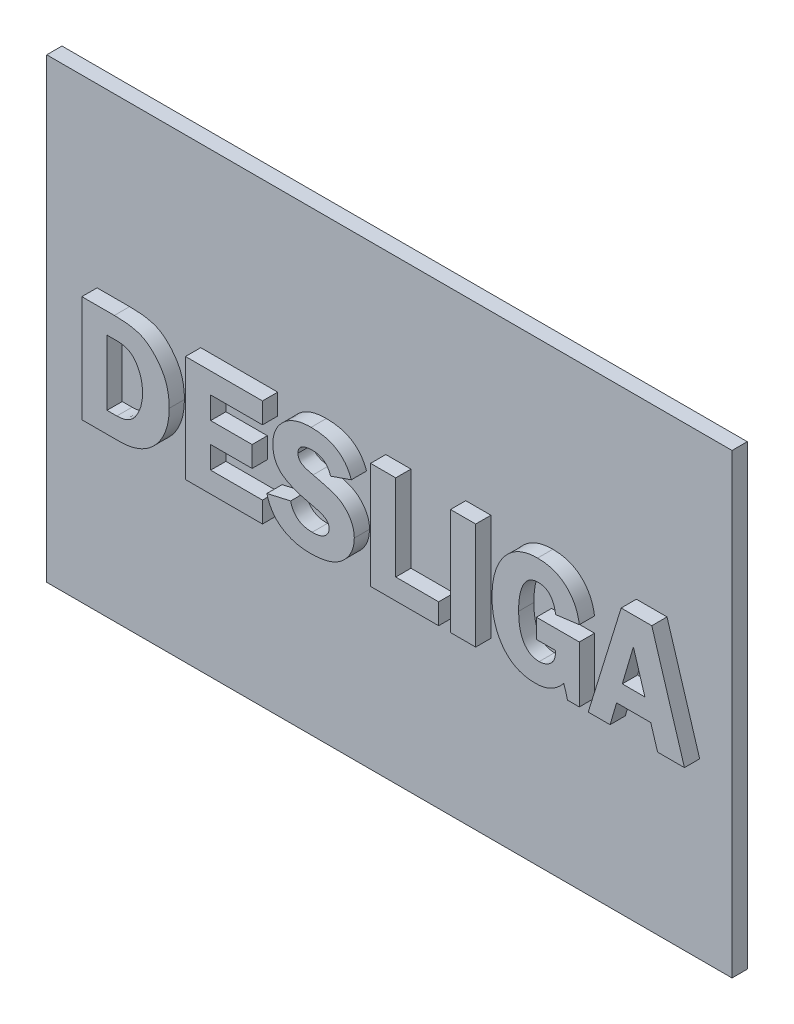
from build123d import *

# Parameters (mm, degrees)
SKETCH1_W           = 22.5
SKETCH1_H           = 15
BOSS_EXTRUDE1_DEPTH = 0.5
WRAP1_OUTLINE_W     = 0.826388889
WRAP1_OUTLINE_H     = 3.5
WRAP1_DEPTH         = 0.5


# Read off the part's stored shape, not the designer's step: Wrap1
with BuildPart() as part:
    # Sketch1 → Boss-Extrude1 (new body)
    with BuildSketch(Plane.XY):
        Rectangle(SKETCH1_W, SKETCH1_H)
    extrude(amount=BOSS_EXTRUDE1_DEPTH)

    # Wrap1 outline → Wrap1 (add)
    # profile 1 of 7: a face of its own
    with BuildSketch(Plane.XY.offset(0.5)):
        with BuildLine():
            add(Edge.make_bspline(
                [(-8.529296875, 1.7), (-8.476622794, 1.699398927), (-8.374497399, 1.698233555), (-8.226766514, 1.689821229), (-8.089315208, 1.676556378), (-7.962218831, 1.656974815), (-7.84546098, 1.631486832), (-7.73913203, 1.600214157), (-7.64289786, 1.564399334), (-7.556298608, 1.520832518), (-7.476364342, 1.471167607), (-7.399209815, 1.416151605), (-7.323999879, 1.354876941), (-7.251672513, 1.28582598), (-7.181306392, 1.210461633), (-7.111715533, 1.129524965), (-7.04624444, 1.04064697), (-6.981057192, 0.947304162), (-6.921903274, 0.846495678), (-6.870067149, 0.738812539), (-6.825864269, 0.624600816), (-6.790331425, 0.503624673), (-6.763196127, 0.376352334), (-6.743613784, 0.242910598), (-6.731038611, 0.103164074), (-6.729798734, 0.007753272), (-6.729166667, -0.040885417)],
                knots=[0, 0, 0, 0, 0.055412427, 0.107434548, 0.15561787, 0.200635297, 0.242642029, 0.281242613, 0.317156341, 0.35050947, 0.383035533, 0.416073422, 0.450144176, 0.48500028, 0.521179711, 0.558593104, 0.597214819, 0.63725789, 0.678326078, 0.720021743, 0.762857988, 0.80702021, 0.852523563, 0.899647618, 0.948842185, 1, 1, 1, 1], degree=3))
            Line((-8.529296875, 1.7), (-9.597222222, 1.7))
            Line((-9.597222222, 1.7), (-9.597222222, -1.8))
            Line((-9.597222222, -1.8), (-8.393337674, -1.8))
            add(Edge.make_bspline(
                [(-6.729166667, -0.040885417), (-6.730448299, -0.102211142), (-6.732966042, -0.222684384), (-6.753727559, -0.39962216), (-6.788719159, -0.568832628), (-6.837134955, -0.730422868), (-6.900081857, -0.884091286), (-6.97574834, -1.030597596), (-7.067116403, -1.168464163), (-7.170309926, -1.298112693), (-7.286263676, -1.415656038), (-7.412927068, -1.519205375), (-7.550658977, -1.606384662), (-7.699226785, -1.677152797), (-7.858068996, -1.732941636), (-8.02746339, -1.77195254), (-8.207054628, -1.796114555), (-8.330216223, -1.798683429), (-8.393337674, -1.8)],
                knots=[0, 0, 0, 0, 0.067496795, 0.132596194, 0.195786319, 0.25750873, 0.318014019, 0.378351522, 0.438726351, 0.499797137, 0.560500469, 0.620136715, 0.679521673, 0.739485285, 0.800925753, 0.864476288, 0.930542851, 1, 1, 1, 1], degree=3))
        make_face()
        with BuildLine():
            add(Edge.make_bspline(
                [(-8.448025174, -1.119444444), (-8.413534158, -1.118417928), (-8.346230568, -1.116414848), (-8.248864258, -1.101041166), (-8.158119368, -1.076188983), (-8.074413307, -1.040301367), (-7.998207338, -0.99336646), (-7.928002141, -0.937509684), (-7.865305916, -0.870615636), (-7.810564077, -0.793873173), (-7.762891567, -0.710542071), (-7.719673119, -0.623845311), (-7.684498701, -0.533118559), (-7.654055073, -0.439544745), (-7.632878954, -0.34166876), (-7.615684292, -0.240637466), (-7.60573809, -0.13577603), (-7.604694744, -0.064704584), (-7.604166667, -0.028732639)],
                knots=[0, 0, 0, 0, 0.066659912, 0.130075943, 0.190052987, 0.248157092, 0.305495311, 0.362601132, 0.421122304, 0.482123317, 0.544418606, 0.60659069, 0.669219716, 0.732382089, 0.796625846, 0.862613796, 0.930463649, 1, 1, 1, 1], degree=3))
            Line((-8.448025174, -1.119444444), (-8.770833333, -1.119444444))
            Line((-8.770833333, -1.119444444), (-8.770833333, 1.019444444))
            Line((-8.770833333, 1.019444444), (-8.440429688, 1.019444444))
            add(Edge.make_bspline(
                [(-7.604166667, -0.028732639), (-7.605643071, 0.021983637), (-7.60855111, 0.121878341), (-7.631114395, 0.26886496), (-7.668364974, 0.409908171), (-7.719550503, 0.542990845), (-7.780944597, 0.663577456), (-7.851191854, 0.767157874), (-7.928542979, 0.851533191), (-8.015429878, 0.915580645), (-8.110001348, 0.962021903), (-8.212153519, 0.995848936), (-8.323458979, 1.015633168), (-8.400599823, 1.018146661), (-8.440429688, 1.019444444)],
                knots=[0, 0, 0, 0, 0.100757571, 0.198459913, 0.294754139, 0.390159564, 0.481299478, 0.563084149, 0.63819658, 0.707634386, 0.776265388, 0.8467526, 0.920874301, 1, 1, 1, 1], degree=3))
        make_face(mode=Mode.SUBTRACT)
    # profile 2 of 7: a face of its own
    with BuildSketch(Plane.XY.offset(0.5)):
        with BuildLine():
            add(Edge.make_bspline(
                [(-1.430555556, 0.679166667), (-1.442733618, 0.713763632), (-1.46617847, 0.780368709), (-1.516180649, 0.870375521), (-1.575852188, 0.946625562), (-1.645303617, 1.009819773), (-1.725507471, 1.057907872), (-1.815159447, 1.092348795), (-1.914454391, 1.113151656), (-1.983908925, 1.115465478), (-2.019965278, 1.116666667)],
                knots=[0, 0, 0, 0, 0.138342651, 0.26633327, 0.386857804, 0.502645831, 0.618922483, 0.737904509, 0.86393678, 1, 1, 1, 1], degree=3))
            Line((-1.430555556, 0.679166667), (-0.75, 0.915386285))
            add(Edge.make_bspline(
                [(-2.070095486, 1.748611111), (-2.028300951, 1.748102149), (-1.946361538, 1.747104315), (-1.826359747, 1.73710837), (-1.712237533, 1.720431135), (-1.603903195, 1.69762318), (-1.500959021, 1.668950024), (-1.403559582, 1.633397985), (-1.312224078, 1.590684082), (-1.226483986, 1.541856971), (-1.146425602, 1.486462927), (-1.072676825, 1.423631959), (-1.004006766, 1.355334172), (-0.941429827, 1.280198207), (-0.884149721, 1.198848987), (-0.833702292, 1.110234935), (-0.787328215, 1.015933641), (-0.762591179, 0.94930191), (-0.75, 0.915386285)],
                knots=[0, 0, 0, 0, 0.074564941, 0.146186756, 0.214678144, 0.280246392, 0.343606264, 0.405208701, 0.465034489, 0.523311842, 0.581086203, 0.638468869, 0.695970567, 0.753698984, 0.812731432, 0.873250871, 0.935484552, 1, 1, 1, 1], degree=3))
            add(Edge.make_bspline(
                [(-3.326388889, 0.645746528), (-3.325397445, 0.683779405), (-3.323445192, 0.758669941), (-3.307097003, 0.868663819), (-3.280292864, 0.97387974), (-3.244108481, 1.075126872), (-3.195484704, 1.170889061), (-3.137732773, 1.263049756), (-3.067850867, 1.349367393), (-2.989450182, 1.43141993), (-2.901197357, 1.505885502), (-2.804821668, 1.571275039), (-2.700541054, 1.626262026), (-2.589039097, 1.671174148), (-2.469951815, 1.706008306), (-2.343407776, 1.73112258), (-2.209163815, 1.745321893), (-2.117220342, 1.747496523), (-2.070095486, 1.748611111)],
                knots=[0, 0, 0, 0, 0.060822979, 0.119766525, 0.177432574, 0.234323837, 0.291383551, 0.348917154, 0.407999705, 0.468729553, 0.530237849, 0.5923632, 0.654692879, 0.718475683, 0.784352605, 0.852905919, 0.924608163, 1, 1, 1, 1], degree=3))
            add(Edge.make_bspline(
                [(-2.088324653, -0.438888889), (-2.142136584, -0.426766261), (-2.246240995, -0.403313858), (-2.394760986, -0.360630077), (-2.532222788, -0.318439117), (-2.656807492, -0.270713742), (-2.770759249, -0.22206043), (-2.871945721, -0.16888535), (-2.962264273, -0.11430167), (-3.040508414, -0.05541836), (-3.109102968, 0.00834852), (-3.166600747, 0.079750645), (-3.216949944, 0.156953982), (-3.256822439, 0.24171376), (-3.28846342, 0.333080094), (-3.309724788, 0.431288513), (-3.324084157, 0.536204106), (-3.325604753, 0.608477065), (-3.326388889, 0.645746528)],
                knots=[0, 0, 0, 0, 0.091059815, 0.17616406, 0.255097275, 0.328394586, 0.396354345, 0.459557131, 0.516989481, 0.570417502, 0.620988649, 0.671199089, 0.721411268, 0.772834051, 0.825452873, 0.880728245, 0.938494365, 1, 1, 1, 1], degree=3))
            add(Edge.make_bspline(
                [(-1.479166667, -0.843728299), (-1.480443127, -0.819215389), (-1.482916131, -0.77172428), (-1.507485855, -0.70492474), (-1.548662179, -0.64759391), (-1.595748779, -0.608538591), (-1.641852825, -0.580872579), (-1.68424724, -0.559737866), (-1.73412012, -0.539767234), (-1.790458586, -0.517861578), (-1.854776738, -0.497865601), (-1.926449098, -0.47856447), (-2.004672016, -0.457441361), (-2.059659868, -0.445246162), (-2.088324653, -0.438888889)],
                knots=[0, 0, 0, 0, 0.092141561, 0.178514301, 0.264076061, 0.355507703, 0.406916782, 0.466686865, 0.53387906, 0.60941054, 0.694550534, 0.787656336, 0.889306727, 1, 1, 1, 1], degree=3))
            add(Edge.make_bspline(
                [(-2.034396701, -1.216666667), (-2.011850656, -1.216462403), (-1.967956827, -1.216064732), (-1.904574177, -1.210511822), (-1.845388023, -1.202406966), (-1.790702954, -1.190433404), (-1.740455624, -1.174413354), (-1.694670754, -1.15545141), (-1.65307713, -1.133581624), (-1.605730275, -1.099589165), (-1.556098327, -1.05225328), (-1.511319451, -0.988281223), (-1.483630771, -0.917762228), (-1.480661919, -0.868525969), (-1.479166667, -0.843728299)],
                knots=[0, 0, 0, 0, 0.090528153, 0.176244975, 0.255342284, 0.330346119, 0.400777935, 0.466877314, 0.529208389, 0.589025037, 0.70050121, 0.802891828, 0.900727154, 1, 1, 1, 1], degree=3))
            add(Edge.make_bspline(
                [(-2.743055556, -0.681944444), (-2.731493194, -0.724191633), (-2.709271514, -0.805386423), (-2.655264842, -0.915728004), (-2.5870185, -1.009327305), (-2.504186936, -1.086304713), (-2.406439106, -1.145606433), (-2.294580144, -1.187078628), (-2.168958331, -1.212502244), (-2.080604307, -1.21523663), (-2.034396701, -1.216666667)],
                knots=[0, 0, 0, 0, 0.134999321, 0.259454936, 0.376869745, 0.49081954, 0.606247793, 0.727472633, 0.857472966, 1, 1, 1, 1], degree=3))
            Line((-2.743055556, -0.681944444), (-3.520833333, -0.857400174))
            add(Edge.make_bspline(
                [(-2.103515625, -1.848611111), (-2.147603464, -1.847997257), (-2.234433844, -1.846788281), (-2.36194597, -1.833810898), (-2.484675545, -1.815533148), (-2.602277014, -1.788061188), (-2.71450966, -1.752098246), (-2.822506612, -1.709759155), (-2.924987334, -1.658635563), (-3.022337275, -1.600434277), (-3.113021171, -1.53426526), (-3.196127826, -1.460437833), (-3.27133414, -1.378742655), (-3.336784047, -1.288603444), (-3.39641216, -1.192409397), (-3.445940668, -1.087642976), (-3.489233855, -0.975870505), (-3.510169228, -0.897381215), (-3.520833333, -0.857400174)],
                knots=[0, 0, 0, 0, 0.070292794, 0.138440668, 0.204233998, 0.26809806, 0.330803893, 0.392068081, 0.452927687, 0.513247683, 0.572774435, 0.631695441, 0.690287576, 0.749488821, 0.809118211, 0.870525963, 0.934048239, 1, 1, 1, 1], degree=3))
            add(Edge.make_bspline(
                [(-0.652777778, -0.692578125), (-0.654058922, -0.731115181), (-0.656591136, -0.80728461), (-0.673346292, -0.919741864), (-0.702587284, -1.027760832), (-0.742255103, -1.13237923), (-0.794172012, -1.232625006), (-0.857542641, -1.328882376), (-0.93308243, -1.420307677), (-1.018114168, -1.508408457), (-1.114975039, -1.589200807), (-1.224193968, -1.658233152), (-1.343182979, -1.718245042), (-1.474273489, -1.765403863), (-1.615904363, -1.803791352), (-1.769056566, -1.829521179), (-1.932768199, -1.845821515), (-2.045495344, -1.847663201), (-2.103515625, -1.848611111)],
                knots=[0, 0, 0, 0, 0.055491637, 0.109680571, 0.163271409, 0.216353888, 0.270487607, 0.325494496, 0.381978448, 0.441017722, 0.501606906, 0.56309432, 0.62668052, 0.693118696, 0.763336429, 0.837718044, 0.916474026, 1, 1, 1, 1], degree=3))
            add(Edge.make_bspline(
                [(-2.006293403, 0.426996528), (-1.963973068, 0.417539559), (-1.881978157, 0.399216847), (-1.763639737, 0.369951635), (-1.653411144, 0.342595371), (-1.55259309, 0.313385511), (-1.460671227, 0.285318728), (-1.377245451, 0.258432531), (-1.303104095, 0.229906704), (-1.215036734, 0.194549505), (-1.114821232, 0.140827133), (-1.005579933, 0.060604765), (-0.906421213, -0.036764216), (-0.833577594, -0.130008349), (-0.78138407, -0.210922605), (-0.746803113, -0.27427392), (-0.718299805, -0.339816007), (-0.693486262, -0.40650827), (-0.675280275, -0.475496985), (-0.662787042, -0.546155682), (-0.653611205, -0.618664172), (-0.653057883, -0.667736502), (-0.652777778, -0.692578125)],
                knots=[0, 0, 0, 0, 0.067356392, 0.130501838, 0.189354541, 0.24375369, 0.293515509, 0.338660425, 0.379857204, 0.41688603, 0.4860338, 0.555805057, 0.626722947, 0.701228271, 0.739083274, 0.776214295, 0.813190872, 0.850016558, 0.886648535, 0.923829508, 0.96144062, 1, 1, 1, 1], degree=3))
            add(Edge.make_bspline(
                [(-2.5, 0.798415799), (-2.499191843, 0.778003712), (-2.497603846, 0.737894733), (-2.478628572, 0.680941928), (-2.451396856, 0.627868004), (-2.417904923, 0.58877022), (-2.38336212, 0.560328572), (-2.349960093, 0.539662765), (-2.309954152, 0.518847188), (-2.262804673, 0.499480197), (-2.208440585, 0.480587519), (-2.147393589, 0.461808217), (-2.079291466, 0.443367255), (-2.03140498, 0.432628113), (-2.006293403, 0.426996528)],
                knots=[0, 0, 0, 0, 0.090152487, 0.177146233, 0.263522091, 0.353506671, 0.40295281, 0.461501338, 0.527277484, 0.60275207, 0.687254619, 0.782419155, 0.88590104, 1, 1, 1, 1], degree=3))
            add(Edge.make_bspline(
                [(-2.019965278, 1.116666667), (-2.057481205, 1.115636377), (-2.127762219, 1.113706268), (-2.226213349, 1.099966932), (-2.310026823, 1.075416221), (-2.379492911, 1.040625942), (-2.434159141, 0.994930376), (-2.472475783, 0.938029035), (-2.496290989, 0.871352437), (-2.498727626, 0.823436669), (-2.5, 0.798415799)],
                knots=[0, 0, 0, 0, 0.172654063, 0.323444029, 0.456152869, 0.572896132, 0.67868651, 0.780172866, 0.885209682, 1, 1, 1, 1], degree=3))
        make_face()
    # profile 3 of 7: a face of its own
    with BuildSketch(Plane.XY.offset(0.5)):
        with BuildLine():
            add(Edge.make_bspline(
                [(6.347222222, -1.8), (6.331268091, -1.731019264), (6.298701545, -1.59021157), (6.25035589, -1.454006194), (6.225694444, -1.38452691)],
                knots=[0, 0, 0, 0, 0.489893232, 1, 1, 1, 1], degree=3))
            Line((6.347222222, -1.8), (6.736111111, -1.8))
            Line((6.736111111, -1.8), (6.736111111, 0.047222222))
            Line((6.736111111, 0.047222222), (5.326388889, 0.047222222))
            Line((5.326388889, 0.047222222), (5.326388889, -0.584722222))
            Line((5.326388889, -0.584722222), (5.958333333, -0.584722222))
            add(Edge.make_bspline(
                [(5.419053819, -1.168055556), (5.453173801, -1.166641415), (5.520724478, -1.163841703), (5.618578284, -1.135479706), (5.711026776, -1.091912059), (5.781689403, -1.041311507), (5.833330118, -0.992684417), (5.866998321, -0.949615289), (5.895038922, -0.901112075), (5.918833464, -0.848077449), (5.936096096, -0.789214567), (5.948614482, -0.72564884), (5.957585994, -0.65687553), (5.958078642, -0.609311898), (5.958333333, -0.584722222)],
                knots=[0, 0, 0, 0, 0.113839351, 0.225378937, 0.337862557, 0.454399889, 0.514282548, 0.574582762, 0.636443988, 0.701264893, 0.768496234, 0.841060889, 0.917830892, 1, 1, 1, 1], degree=3))
            add(Edge.make_bspline(
                [(4.743055556, -0.076584201), (4.743738979, -0.119635576), (4.745062691, -0.203021042), (4.752384646, -0.32423507), (4.765634885, -0.437450039), (4.785981056, -0.542753882), (4.809333357, -0.640850258), (4.840075091, -0.730891969), (4.875445062, -0.813189447), (4.916468672, -0.887392166), (4.962938176, -0.953045942), (5.014059229, -1.010472833), (5.069711353, -1.059907744), (5.130847705, -1.099399842), (5.196502116, -1.130329733), (5.266494208, -1.152255059), (5.341338901, -1.165456245), (5.392668063, -1.167173038), (5.419053819, -1.168055556)],
                knots=[0, 0, 0, 0, 0.089605155, 0.173554681, 0.252640076, 0.326637626, 0.396673525, 0.462328207, 0.524393538, 0.582893738, 0.638453156, 0.691446992, 0.742603933, 0.792882167, 0.842383995, 0.893214225, 0.945106771, 1, 1, 1, 1], degree=3))
            add(Edge.make_bspline(
                [(5.384874132, 1.068055556), (5.359242504, 1.067210899), (5.309116161, 1.065559051), (5.236133697, 1.051696413), (5.168076134, 1.028085171), (5.104981075, 0.994871993), (5.046758474, 0.952846932), (4.994010916, 0.901059239), (4.945763552, 0.840386196), (4.902822918, 0.770352319), (4.864992229, 0.691866233), (4.83245544, 0.605321415), (4.804441163, 0.511186428), (4.781700712, 0.408895639), (4.764720998, 0.298727159), (4.751690808, 0.180656658), (4.744127232, 0.054664626), (4.743419483, -0.03201382), (4.743055556, -0.076584201)],
                knots=[0, 0, 0, 0, 0.052392573, 0.102461232, 0.15126336, 0.199209074, 0.247788165, 0.29759102, 0.349914456, 0.405956949, 0.465245134, 0.527852777, 0.594860669, 0.665966982, 0.741990387, 0.822734633, 0.908849485, 1, 1, 1, 1], degree=3))
            add(Edge.make_bspline(
                [(5.958333333, 0.436111111), (5.954320422, 0.461736316), (5.946533738, 0.511459652), (5.930359405, 0.583185082), (5.911664367, 0.649991098), (5.88948936, 0.711876638), (5.864705334, 0.768921126), (5.836341328, 0.820915366), (5.805458143, 0.868236988), (5.7708395, 0.910237935), (5.733755897, 0.948097333), (5.692313413, 0.97958563), (5.648977442, 1.00755935), (5.601877947, 1.02959383), (5.552027941, 1.047089034), (5.498748596, 1.059092439), (5.442838818, 1.066996713), (5.404397178, 1.067698927), (5.384874132, 1.068055556)],
                knots=[0, 0, 0, 0, 0.082191489, 0.159484973, 0.232898467, 0.301940512, 0.367695662, 0.429819924, 0.48946921, 0.54649677, 0.602106423, 0.65700512, 0.711106214, 0.765308393, 0.821396578, 0.878237506, 0.938161464, 1, 1, 1, 1], degree=3))
            Line((5.958333333, 0.436111111), (6.736111111, 0.537890625))
            add(Edge.make_bspline(
                [(5.365885417, 1.748611111), (5.413019016, 1.747570689), (5.505259051, 1.745534592), (5.640201109, 1.730174961), (5.768194097, 1.704764538), (5.889023759, 1.667729236), (6.003392192, 1.621890079), (6.110137081, 1.564492815), (6.209903475, 1.497041103), (6.302109963, 1.419502923), (6.387389675, 1.333869175), (6.463301074, 1.240180481), (6.530398114, 1.13974161), (6.590253689, 1.033221224), (6.640056312, 0.919073074), (6.681171684, 0.798088035), (6.713991914, 0.670596043), (6.728662123, 0.582581264), (6.736111111, 0.537890625)],
                knots=[0, 0, 0, 0, 0.070069074, 0.137124556, 0.201650146, 0.263813257, 0.324771258, 0.384560312, 0.443656803, 0.503520473, 0.563413726, 0.623088901, 0.682497508, 0.742828077, 0.80451978, 0.867376611, 0.932658764, 1, 1, 1, 1], degree=3))
            add(Edge.make_bspline(
                [(3.868055556, -0.097092014), (3.869110038, -0.029193424), (3.8711683, 0.103338977), (3.890449903, 0.296809121), (3.922242527, 0.479850097), (3.966246567, 0.652858131), (4.022108878, 0.816068001), (4.09157708, 0.968937488), (4.173823781, 1.111319656), (4.267695798, 1.243069192), (4.373216234, 1.361084804), (4.487216822, 1.46596394), (4.612288639, 1.552519732), (4.745208729, 1.624841653), (4.887630667, 1.680557916), (5.039133601, 1.71955882), (5.199450013, 1.744948697), (5.309579173, 1.747372091), (5.365885417, 1.748611111)],
                knots=[0, 0, 0, 0, 0.076094269, 0.148529686, 0.217678594, 0.284172559, 0.348435986, 0.410796815, 0.472084106, 0.532492434, 0.591791888, 0.649255708, 0.705707708, 0.761835604, 0.81854385, 0.876643326, 0.936930864, 1, 1, 1, 1], degree=3))
            add(Edge.make_bspline(
                [(5.288411458, -1.848611111), (5.233889737, -1.847238309), (5.127386457, -1.844556663), (4.972339955, -1.821117291), (4.826223803, -1.783836147), (4.690180418, -1.729005295), (4.562589395, -1.660627785), (4.445398823, -1.575256979), (4.336319765, -1.476073515), (4.23906332, -1.360905337), (4.152272554, -1.234286084), (4.075875591, -1.098351542), (4.011028761, -0.953529332), (3.958903726, -0.799278052), (3.917638439, -0.636281671), (3.889449872, -0.464234977), (3.871476997, -0.28356275), (3.869213096, -0.160178706), (3.868055556, -0.097092014)],
                knots=[0, 0, 0, 0, 0.064345405, 0.125692964, 0.184718006, 0.242009577, 0.298461161, 0.355213548, 0.412768934, 0.472141974, 0.532760404, 0.593797592, 0.656024627, 0.719840029, 0.785822383, 0.854335256, 0.925521109, 1, 1, 1, 1], degree=3))
            add(Edge.make_bspline(
                [(6.225694444, -1.38452691), (6.194850513, -1.421481302), (6.134358044, -1.493957872), (6.031661328, -1.587913316), (5.924030917, -1.668972518), (5.809204372, -1.734766305), (5.687740043, -1.785831157), (5.560080287, -1.822576666), (5.426106507, -1.844019509), (5.334820234, -1.847063556), (5.288411458, -1.848611111)],
                knots=[0, 0, 0, 0, 0.133004575, 0.260854394, 0.383963685, 0.505044677, 0.625870246, 0.747551188, 0.871658247, 1, 1, 1, 1], degree=3))
        make_face()
    # profile 4 of 7: a face of its own
    with BuildSketch(Plane.XY.offset(0.5)):
        Polygon((-6.194444444, -1.8), (-3.666666667, -1.8), (-3.666666667, -1.119444444), (-5.368055556, -1.119444444), (-5.368055556, -0.390277778), (-4.006944444, -0.390277778), (-4.006944444, 0.290277778), (-5.368055556, 0.290277778), (-5.368055556, 1.019444444), (-3.666666667, 1.019444444), (-3.666666667, 1.7), (-6.194444444, 1.7), align=None)
    # profile 5 of 7: a face of its own
    with BuildSketch(Plane.XY.offset(0.5)):
        Polygon((-0.118055556, -1.8), (2.118055556, -1.8), (2.118055556, -1.119444444), (0.708333333, -1.119444444), (0.708333333, 1.7), (-0.118055556, 1.7), align=None)
    # profile 6 of 7: a face of its own
    with BuildSketch(Plane.XY.offset(0.5)):
        with Locations((2.920138889, -0.05)):
            Rectangle(WRAP1_OUTLINE_W, WRAP1_OUTLINE_H)
    # profile 7 of 7: a face of its own
    with BuildSketch(Plane.XY.offset(0.5)):
        Polygon((9.305664062, -1.8), (10.1875, -1.8), (9.115017361, 1.7), (8.109375, 1.7), (7.027777778, -1.8), (7.745551215, -1.8), (7.960503472, -1.070833333), (9.082356771, -1.070833333), align=None)
        Polygon((8.510416667, 0.795377604), (8.888671875, -0.438888889), (8.146592882, -0.438888889), align=None, mode=Mode.SUBTRACT)
    extrude(amount=WRAP1_DEPTH)


solid = part.part
